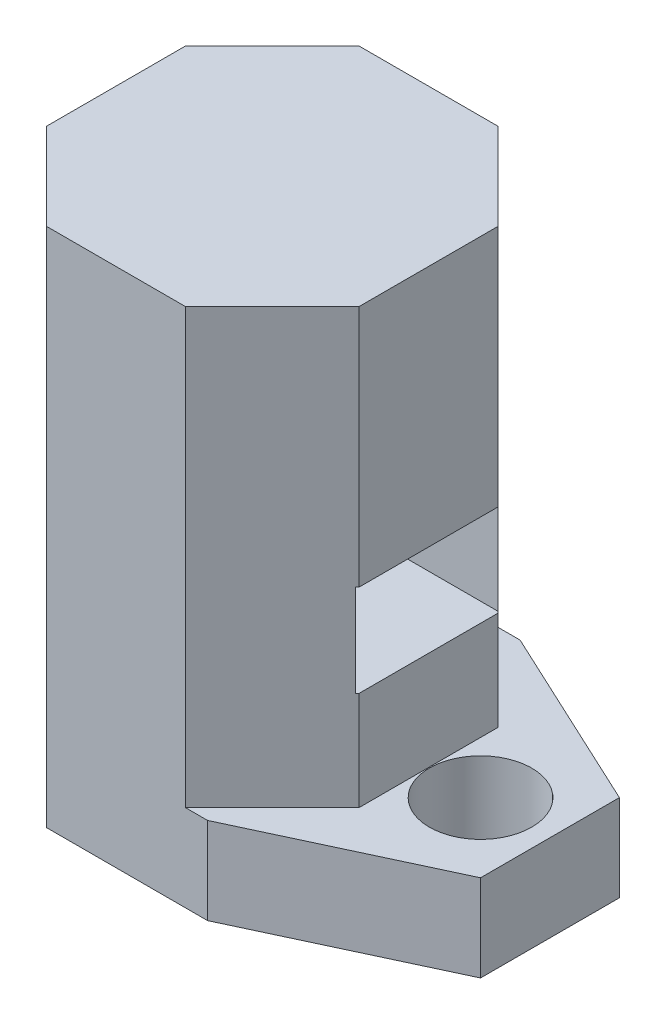
from build123d import *

# Parameters (mm, degrees)
SKETCH1_W           = 18
SKETCH1_H           = 30
BOSS_EXTRUDE1_DEPTH = 9
SKETCH2_R           = 5.25
CUT_EXTRUDE1_DEPTH  = 6
SKETCH4_R           = 2.75
CUT_EXTRUDE3_DEPTH  = 28
CUT_EXTRUDE4_REACH  = 38.125
SKETCH5_W           = 8.2
SKETCH5_H           = 5.3
CHAMFER3_SIZE       = 5
SKETCH6_R           = 2.95
BOSS_EXTRUDE2_DEPTH = 5
CHAMFER4_SIZE       = 5
CHAMFER4_SIZE2      = 10.722534603


with BuildPart() as part:
    # Sketch1 → Boss-Extrude1 (new, symmetric)
    with BuildSketch(Plane.XY):
        with Locations((-5, -15)):
            Rectangle(SKETCH1_W, SKETCH1_H)
    extrude(amount=BOSS_EXTRUDE1_DEPTH, both=True)

    # Sketch2 → Cut-Extrude1 (cut)
    with BuildSketch(Plane.XZ.offset(30)):
        with Locations((-5, 0)):
            Circle(SKETCH2_R)
    extrude(amount=-CUT_EXTRUDE1_DEPTH, mode=Mode.SUBTRACT)

    # Sketch4 → Cut-Extrude3 (cut)
    with BuildSketch(Plane.XZ.offset(30)):
        with Locations((-5, 0)):
            Circle(SKETCH4_R)
    extrude(amount=-CUT_EXTRUDE3_DEPTH, mode=Mode.SUBTRACT)

    # Sketch5 → Cut-Extrude4 (cut, up to next)
    with BuildSketch(Plane(origin=(4, 0, 0), x_dir=(0, 0, -1), z_dir=(1, 0, 0)), mode=Mode.PRIVATE) as cut_extrude4_sk1:
        with Locations((0, -16.65)):
            Rectangle(SKETCH5_W, SKETCH5_H)
    cut_extrude4_tool1 = extrude(cut_extrude4_sk1.sketch, amount=-CUT_EXTRUDE4_REACH, mode=Mode.PRIVATE) & part.part
    add(cut_extrude4_tool1.solids().sort_by_distance((4, -16.65, 0))[0], mode=Mode.SUBTRACT)

    # Chamfer3
    # the kernel refuses this chamfer: 5 mm, written as the material it takes off along each edge
    with BuildSketch(Plane(origin=(-14, -42.85841494, 9), x_dir=(0.9996219169112968, 0, 0.027495876610586317), z_dir=(0, 1, 0)), Plane(origin=(4, 12.85841494, -9), x_dir=(0.027495876610586317, 0, 0.9996219169112968), z_dir=(0, -1, 0))) as chamfer3_piece_1:
        Polygon((CHAMFER3_SIZE * 0.999621916911, CHAMFER3_SIZE * 0.0274958766106), (-CHAMFER3_SIZE * 0.0274958766106, CHAMFER3_SIZE * 0.999621916911), (0, 0), align=None)
    extrude(amount=55.71682988, mode=Mode.SUBTRACT)
    with BuildSketch(Plane(origin=(-14, -42.85841494, -9), x_dir=(0.9996219169112968, 0, -0.027495876610586317), z_dir=(0, 1, 0)), Plane(origin=(4, 12.85841494, 9), x_dir=(0.027495876610586317, 0, -0.9996219169112968), z_dir=(0, -1, 0))) as chamfer3_piece_2:
        Polygon((CHAMFER3_SIZE * 0.999621916911, -CHAMFER3_SIZE * 0.0274958766106), (-CHAMFER3_SIZE * 0.0274958766106, -CHAMFER3_SIZE * 0.999621916911), (0, 0), align=None)
    extrude(amount=55.71682988, mode=Mode.SUBTRACT)

    # Sketch6 → Boss-Extrude2 (add)
    with BuildSketch(Plane.XZ.offset(30)):
        Polygon((-1, -9), (11, -9), (11, 9), (-1, 9), (4, 4), (4, -4), align=None)
        with Locations((7, 0)):
            Circle(SKETCH6_R, mode=Mode.SUBTRACT)
    extrude(amount=-BOSS_EXTRUDE2_DEPTH)

    # Chamfer4
    chamfer4_edges = [part.edges().sort_by_distance(p)[0] for p in [
        (11, -27.5, 9),
        (11, -27.5, -9),
    ]]
    chamfer4_side = [part.faces().sort_by_distance(p)[0] for p in [
        (11, -27.5, 0),
    ]]
    chamfer(chamfer4_edges, length=CHAMFER4_SIZE, length2=CHAMFER4_SIZE2, reference=chamfer4_side[0])


solid = part.part
